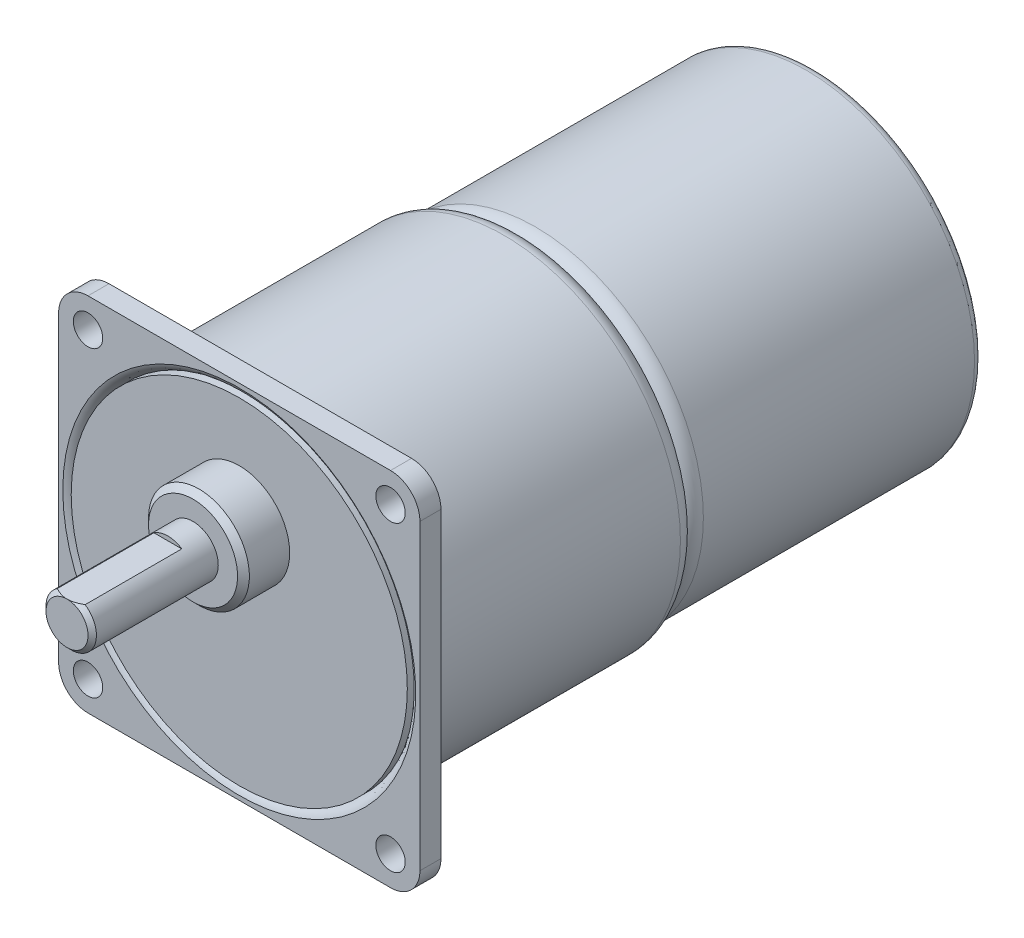
from build123d import *

# Parameters (mm, degrees)
SKETCH1_R           = 1.75
BOSS_EXTRUDE1_DEPTH = 2.5
SKETCH2_R           = 6
BOSS_EXTRUDE2_DEPTH = 5.5
SKETCH3_R           = 3
BOSS_EXTRUDE3_DEPTH = 15
CHAMFER1_SIZE       = 0.7
SKETCH4_W           = 12
SKETCH4_H           = 2.8
CUT_EXTRUDE1_DEPTH  = 66.015382795
CHAMFER2_SIZE       = 0.5
SKETCH5_R           = 21
BOSS_EXTRUDE4_DEPTH = 31
FILLET1_R           = 2
SKETCH6_R           = 20
BOSS_EXTRUDE5_DEPTH = 35
FILLET2_R           = 2
FILLET3_R           = 1


# Some blends are built 0.0001 mm under size
with BuildPart() as part:
    # Sketch1 → Boss-Extrude1 (new body)
    with BuildSketch(Plane.XY):
        with BuildLine():
            Line((3.5, 0), (39.5, 0))
            ThreePointArc((39.5, 0), (41.974873734, -1.025126266), (43, -3.5))
            Line((43, -3.5), (43, -39.5))
            ThreePointArc((43, -39.5), (41.974873734, -41.974873734), (39.5, -43))
            Line((39.5, -43), (3.5, -43))
            ThreePointArc((3.5, -43), (1.025126266, -41.974873734), (0, -39.5))
            Line((0, -39.5), (0, -3.5))
            ThreePointArc((0, -3.5), (1.025126266, -1.025126266), (3.5, 0))
        make_face()
        with Locations((3.5, -3.5)):
            Circle(SKETCH1_R, mode=Mode.SUBTRACT)
        with Locations((39.5, -3.5)):
            Circle(SKETCH1_R, mode=Mode.SUBTRACT)
        with Locations((3.5, -39.5)):
            Circle(SKETCH1_R, mode=Mode.SUBTRACT)
        with Locations((39.5, -39.5)):
            Circle(SKETCH1_R, mode=Mode.SUBTRACT)
    extrude(amount=BOSS_EXTRUDE1_DEPTH)

    # Sketch2 → Boss-Extrude2 (add)
    with BuildSketch(Plane.XY.offset(2.5)):
        with Locations((21.5, -14.5)):
            Circle(SKETCH2_R)
    extrude(amount=BOSS_EXTRUDE2_DEPTH)

    # Sketch3 → Boss-Extrude3 (add)
    with BuildSketch(Plane.XY.offset(8)):
        with Locations((21.5, -14.5)):
            Circle(SKETCH3_R)
    extrude(amount=BOSS_EXTRUDE3_DEPTH)

    # Chamfer1
    chamfer1_edges = [part.edges().sort_by_distance(p)[0] for p in [
        (15.5, -14.5, 8),
    ]]
    chamfer(chamfer1_edges, length=CHAMFER1_SIZE)

    # Sketch4 → Cut-Extrude1 (cut, through all)
    with BuildSketch(Plane(origin=(43, 0, 0), x_dir=(0, 0, -1), z_dir=(1, 0, 0))):
        with Locations((-17, -10.6)):
            Rectangle(SKETCH4_W, SKETCH4_H)
    extrude(amount=-CUT_EXTRUDE1_DEPTH, mode=Mode.SUBTRACT)

    # Chamfer2
    chamfer2_edges = [part.edges().sort_by_distance(p)[0] for p in [
        (20.081362835, -17.143382037, 23),
    ]]
    chamfer(chamfer2_edges, length=CHAMFER2_SIZE - 0.0001)  # a hair under: the kernel refuses the full size

    # Sketch5 → Boss-Extrude4 (add)
    with BuildSketch(Plane(origin=(0, 0, 0), x_dir=(-1, 0, 0), z_dir=(0, 0, -1))):
        with Locations(Location((-21.5, -21.5, 0), (0, 0, 180))):
            Circle(SKETCH5_R)
    extrude(amount=BOSS_EXTRUDE4_DEPTH)

    # Fillet1
    fillet1_edges = [part.edges().sort_by_distance(p)[0] for p in [
        (0.5, -21.5, -31),
    ]]
    fillet(fillet1_edges, radius=FILLET1_R)

    # Sketch6 → Boss-Extrude5 (add)
    with BuildSketch(Plane(origin=(0, 0, -31), x_dir=(-1, 0, 0), z_dir=(0, 0, -1))):
        with Locations((-21.5, -21.5)):
            Circle(SKETCH6_R)
    extrude(amount=BOSS_EXTRUDE5_DEPTH)

    # Fillet2
    # the kernel refuses this fillet: 2 mm, written as the material it takes off along each edge
    with BuildSketch(Plane(origin=(21.5, -21.5, -31), x_dir=(-1, 0, 0), z_dir=(0, -1, 0))) as fillet2_piece_1:
        with BuildLine():
            CenterArc((18, 1.732050808), FILLET2_R, 300, 60)
            Line((19, 0), (20, 0))
            Line((20, 0), (20, 1.732050808))
        make_face()
    revolve(axis=Axis((21.5, -21.5, -31), (0, 0, -1)), mode=Mode.SUBTRACT)

    # Fillet3
    fillet3_edges = [part.edges().sort_by_distance(p)[0] for p in [
        (41.5, -21.5, -66),
    ]]
    fillet(fillet3_edges, radius=FILLET3_R)

    # Sketch7 → Cut-Revolve1 (revolve, cut)
    with BuildSketch(Plane(origin=(21.5, 0, 0), x_dir=(0, 0, -1), z_dir=(1, 0, 0)), mode=Mode.PRIVATE) as cut_revolve1_sk:
        with BuildLine():
            Line((-2.5, -1.5), (-1.5, -1.5))
            add(Edge.make_bspline(
                [(-2.5, -0.5), (-2.2, -1.2), (-1.5, -1.5)],
                knots=[0, 0, 0, 1, 1, 1], degree=2))
            Line((-2.5, -0.5), (-2.5, -1.5))
        make_face()
    revolve(cut_revolve1_sk.sketch.rotate(Axis((21.5, -21.5, -66), (0, 0, 1)), 90), axis=Axis((21.5, -21.5, -66), (0, 0, 1)), mode=Mode.SUBTRACT)


solid = part.part
